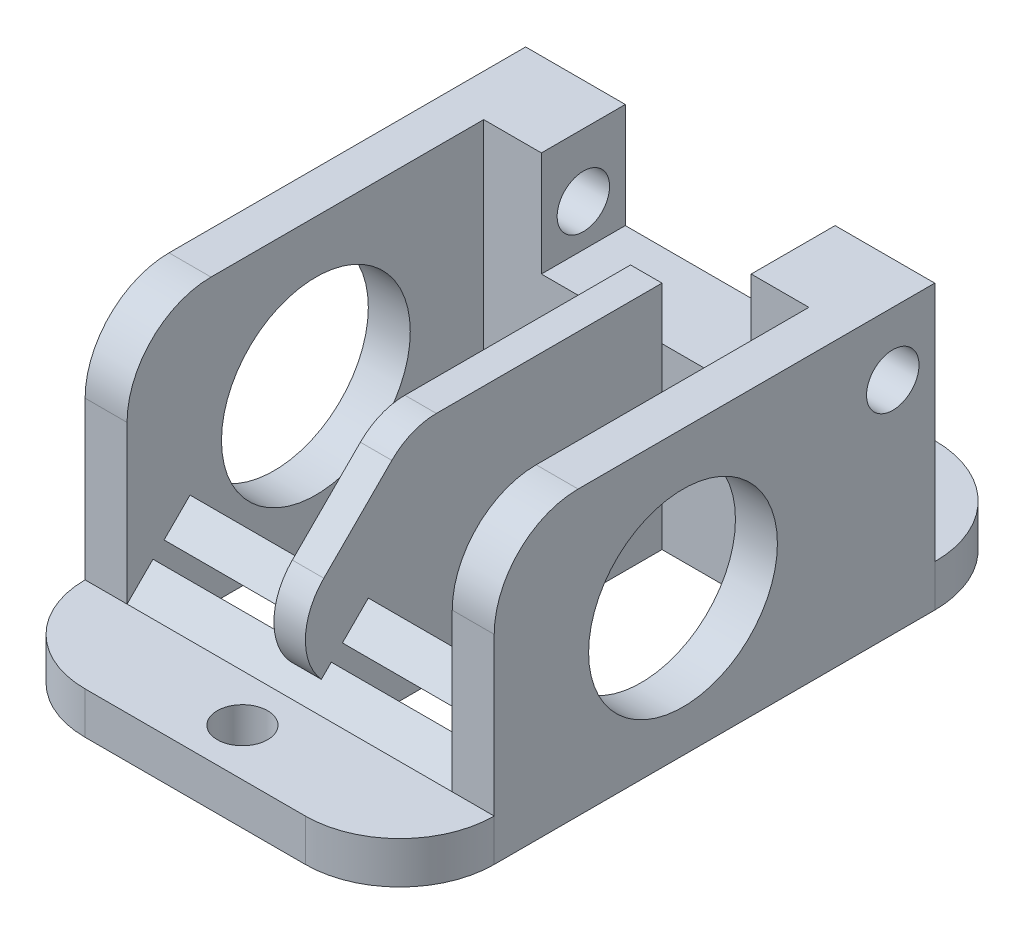
from build123d import *

# Parameters (mm, degrees)
BOSS_EXTRUDE7_DEPTH  = 13.5
SKETCH22_R           = 4.5
CUT_EXTRUDE4_DEPTH   = 41.776818177
SKETCH9_W            = 1.5
SKETCH9_H            = 17
BOSS_EXTRUDE8_DEPTH  = 11
BOSS_EXTRUDE9_DEPTH  = 2
FILLET1_R            = 4
SKETCH11_W           = 10
SKETCH11_H           = 4
CUT_EXTRUDE1_DEPTH   = 5
CHAMFER2_SIZE        = 5
FILLET2_R            = 3
SKETCH12_R           = 1.25
CUT_EXTRUDE2_DEPTH   = 12.5
M2_CLEARANCE_HOLE1_D = 2.4
BOSS_EXTRUDE10_DEPTH = 2
M2_CLEARANCE_HOLE2_D = 2.4
SKETCH20_W           = 15.5
SKETCH20_H           = 8
BOSS_EXTRUDE11_DEPTH = 5.5
CHAMFER3_SIZE        = 5.5
CHAMFER4_START       = -35.400000065
CHAMFER4_DEPTH       = 7
CHAMFER4_START_2     = -26.900000065
CHAMFER4_2_DEPTH     = 7
CHAMFER4_START_3     = -28.400000065
CHAMFER4_3_DEPTH     = 1.5
SKETCH21_W           = 7
SKETCH21_H           = 0.75
CUT_EXTRUDE3_DEPTH   = 46.949966868
LPATTERN1_COUNT      = 2
LPATTERN1_PITCH      = 8.5


with BuildPart() as part:
    # Sketch8 → Boss-Extrude7 (new body)
    with BuildSketch(Plane(origin=(0, 0, 0), x_dir=(1, 0, 0), z_dir=(0, 1, 0))):
        Polygon((-37.400000065, -12.17000001), (-37.400000065, -33.17000001), (-35.400000065, -33.17000001), (-35.400000065, -16.17000001), (-19.900000065, -16.17000001), (-19.900000065, -33.17000001), (-17.900000065, -33.17000001), (-17.900000065, -12.17000001), align=None)
    extrude(amount=BOSS_EXTRUDE7_DEPTH)

    # Sketch22 → Cut-Extrude4 (cut, through all)
    with BuildSketch(Plane.ZY.offset(37.400000065)):
        with Locations((24.17000001, 6.5)):
            Circle(SKETCH22_R)
    extrude(amount=-CUT_EXTRUDE4_DEPTH, mode=Mode.SUBTRACT)

    # Sketch9 → Boss-Extrude8 (add)
    with BuildSketch(Plane(origin=(0, 0, 0), x_dir=(1, 0, 0), z_dir=(0, 1, 0))):
        with Locations((-27.650000065, -24.67000001)):
            Rectangle(SKETCH9_W, SKETCH9_H)
    extrude(amount=BOSS_EXTRUDE8_DEPTH)

    # Sketch10 → Boss-Extrude9 (add)
    with BuildSketch(Plane(origin=(0, 0, 0), x_dir=(1, 0, 0), z_dir=(0, 1, 0))):
        with BuildLine():
            Line((-37.400000065, -30.17000001), (-17.900000065, -30.17000001))
            Line((-17.900000065, -30.17000001), (-17.900000065, -33.17000001))
            ThreePointArc((-17.900000065, -33.17000001), (-19.218019549, -36.351980525), (-22.400000065, -37.67000001))
            Line((-22.400000065, -37.67000001), (-32.900000065, -37.67000001))
            ThreePointArc((-32.900000065, -37.67000001), (-36.08198058, -36.351980525), (-37.400000065, -33.17000001))
            Line((-37.400000065, -33.17000001), (-37.400000065, -30.17000001))
        make_face()
    extrude(amount=BOSS_EXTRUDE9_DEPTH)

    # Fillet1
    fillet1_edges = [part.edges().sort_by_distance(p)[0] for p in [
        (-36.400000065, 13.5, 33.17000001),
        (-18.900000065, 13.5, 33.17000001),
    ]]
    fillet(fillet1_edges, radius=FILLET1_R)

    # Sketch11 → Cut-Extrude1 (cut)
    with BuildSketch(Plane(origin=(0, 13.5, 0), x_dir=(1, 0, 0), z_dir=(0, 1, 0))):
        with Locations((-27.650000065, -14.17000001)):
            Rectangle(SKETCH11_W, SKETCH11_H)
    extrude(amount=-CUT_EXTRUDE1_DEPTH, mode=Mode.SUBTRACT)

    # Chamfer2
    chamfer2_edges = [part.edges().sort_by_distance(p)[0] for p in [
        (-27.650000065, 11, 33.17000001),
    ]]
    chamfer(chamfer2_edges, length=CHAMFER2_SIZE)

    # Fillet2
    fillet2_edges = [part.edges().sort_by_distance(p)[0] for p in [
        (-27.650000065, 11, 28.17000001),
        (-27.650000065, 6, 33.17000001),
    ]]
    fillet(fillet2_edges, radius=FILLET2_R)

    # Sketch12 → Cut-Extrude2 (cut, symmetric)
    with BuildSketch(Plane.ZY.offset(27.650000065)):
        with Locations((14.17000001, 10.5)):
            Circle(SKETCH12_R)
    extrude(amount=CUT_EXTRUDE2_DEPTH, both=True, mode=Mode.SUBTRACT)

    # M2 Clearance Hole1 (through all)
    with Locations(Plane(origin=(-27.650000065, 2, 35.42000001), x_dir=(0, 0, 1), z_dir=(0, 1, 0))):
        with Locations((0, 0)):
            Hole(M2_CLEARANCE_HOLE1_D / 2)

    # Sketch17 → Boss-Extrude10 (add)
    with BuildSketch(Plane(origin=(0, 0, 0), x_dir=(1, 0, 0), z_dir=(0, 1, 0))):
        with BuildLine():
            Line((-32.400000065, -7.17000001), (-22.900000065, -7.17000001))
            ThreePointArc((-22.900000065, -7.17000001), (-19.364466159, -8.634466104), (-17.900000065, -12.17000001))
            Line((-17.900000065, -12.17000001), (-17.900000065, -14.17000001))
            Line((-17.900000065, -14.17000001), (-37.400000065, -14.17000001))
            Line((-37.400000065, -14.17000001), (-37.400000065, -12.17000001))
            ThreePointArc((-37.400000065, -12.17000001), (-35.935533971, -8.634466104), (-32.400000065, -7.17000001))
        make_face()
    extrude(amount=BOSS_EXTRUDE10_DEPTH)

    # M2 Clearance Hole2 (through all)
    with Locations(Plane(origin=(-31.650000065, 2, 9.67000001), x_dir=(0, 0, 1), z_dir=(0, 1, 0))):
        with Locations((0, 0), (0, 8)):
            Hole(M2_CLEARANCE_HOLE2_D / 2)

    # Sketch20 → Boss-Extrude11 (add)
    with BuildSketch(Plane(origin=(0, 0, 0), x_dir=(1, 0, 0), z_dir=(0, 1, 0))):
        with Locations((-27.650000065, -29.17000001)):
            Rectangle(SKETCH20_W, SKETCH20_H)
    extrude(amount=BOSS_EXTRUDE11_DEPTH)

    # Chamfer3
    # the kernel refuses this chamfer: 5.5 mm, written as the material it takes off along each edge
    with BuildSketch(Plane(origin=(-14.255743631, 5.5, 25.17000001), x_dir=(0, 0, 1), z_dir=(-1, 0, 0))) as chamfer3_piece_1_section:
        Polygon((CHAMFER3_SIZE, 0), (0, -CHAMFER3_SIZE), (0, 0), align=None)
    chamfer3_piece_1 = extrude(amount=35.288512868, mode=Mode.PRIVATE)
    chamfer3_piece_1 = split(chamfer3_piece_1, bisect_by=Plane(origin=(-26.900000065, 5.5, 25.17000001), z_dir=(1, 0, 0)), keep=Keep.TOP, mode=Mode.PRIVATE)
    chamfer3_piece_1 = split(chamfer3_piece_1, bisect_by=Plane(origin=(-19.900000065, 5.5, 25.17000001), z_dir=(-1, 0, 0)), keep=Keep.TOP, mode=Mode.PRIVATE)
    add(chamfer3_piece_1, mode=Mode.SUBTRACT)
    with BuildSketch(Plane(origin=(-28.400000065, 5.5, 25.17000001), x_dir=(0, 0, 1), z_dir=(-1, 0, 0)), Plane(origin=(-19.900000065, 5.5, 25.17000001), x_dir=(0, 0, 1), z_dir=(-1, 0, 0))) as chamfer3_piece_2:
        Polygon((CHAMFER3_SIZE, 0), (0, -CHAMFER3_SIZE), (0, 0), align=None)
    extrude(amount=7, mode=Mode.SUBTRACT)
    with BuildSketch(Plane(origin=(-5.755743631, 5.5, 25.17000001), x_dir=(0, 0, 1), z_dir=(-1, 0, 0))) as chamfer3_piece_3_section:
        Polygon((CHAMFER3_SIZE, 0), (0, -CHAMFER3_SIZE), (0, 0), align=None)
    chamfer3_piece_3 = extrude(amount=35.288512868, mode=Mode.PRIVATE)
    chamfer3_piece_3 = split(chamfer3_piece_3, bisect_by=Plane(origin=(-28.400000065, 5.5, 25.17000001), z_dir=(-1, 0, 0)), keep=Keep.TOP, mode=Mode.PRIVATE)
    chamfer3_piece_3 = split(chamfer3_piece_3, bisect_by=Plane(origin=(-35.400000065, 5.5, 25.17000001), z_dir=(1, 0, 0)), keep=Keep.TOP, mode=Mode.PRIVATE)
    add(chamfer3_piece_3, mode=Mode.SUBTRACT)

    # Chamfer4: read off the stored shape, not the designer's step
    # Chamfer4 outline → Chamfer4 (cut)
    with BuildSketch(Plane.YZ.offset(CHAMFER4_START)):
        Polygon((5.5, 30.67000001), (5.5, 33.17000001), (2, 33.17000001), (5, 30.17000001), align=None)
    extrude(amount=CHAMFER4_DEPTH, mode=Mode.SUBTRACT)

    # Chamfer4 2 outline → Chamfer4 2 (cut)
    with BuildSketch(Plane.YZ.offset(CHAMFER4_START_2)):
        Polygon((5.5, 30.67000001), (5.5, 33.17000001), (2, 33.17000001), (5, 30.17000001), align=None)
    extrude(amount=CHAMFER4_2_DEPTH, mode=Mode.SUBTRACT)

    # Chamfer4 3 outline → Chamfer4 3 (cut)
    with BuildSketch(Plane.YZ.offset(CHAMFER4_START_3)):
        with BuildLine():
            ThreePointArc((4.757359313, 33.17000001), (5.131603073, 33.146565415), (5.5, 33.076627748))
            Line((5.5, 33.076627748), (5.5, 33.17000001))
            Line((5.5, 33.17000001), (4.757359313, 33.17000001))
        make_face()
        with BuildLine():
            ThreePointArc((2.760831368, 32.409168642), (3.689067662, 32.973346751), (4.757359313, 33.17000001))
            Line((4.757359313, 33.17000001), (2, 33.17000001))
            Line((2, 33.17000001), (2.760831368, 32.409168642))
        make_face()
    extrude(amount=CHAMFER4_3_DEPTH, mode=Mode.SUBTRACT)

    # Sketch21 → Cut-Extrude3 (cut, through all)
    with BuildSketch(Plane(origin=(0, 17.585000005, 17.585000005), x_dir=(1, 0, 0), z_dir=(0, 0.7071067811865511, 0.707106781186544))):
        with Locations((-31.900000065, -19.919198033)):
            Rectangle(SKETCH21_W, SKETCH21_H)
    cut_extrude3 = extrude(amount=-CUT_EXTRUDE3_DEPTH, mode=Mode.SUBTRACT)

    # LPattern1: Cut-Extrude3 ×2
    with Locations(*[(i * LPATTERN1_PITCH, 0, 0) for i in range(1, LPATTERN1_COUNT)]):
        add(cut_extrude3, mode=Mode.SUBTRACT)


solid = part.part
